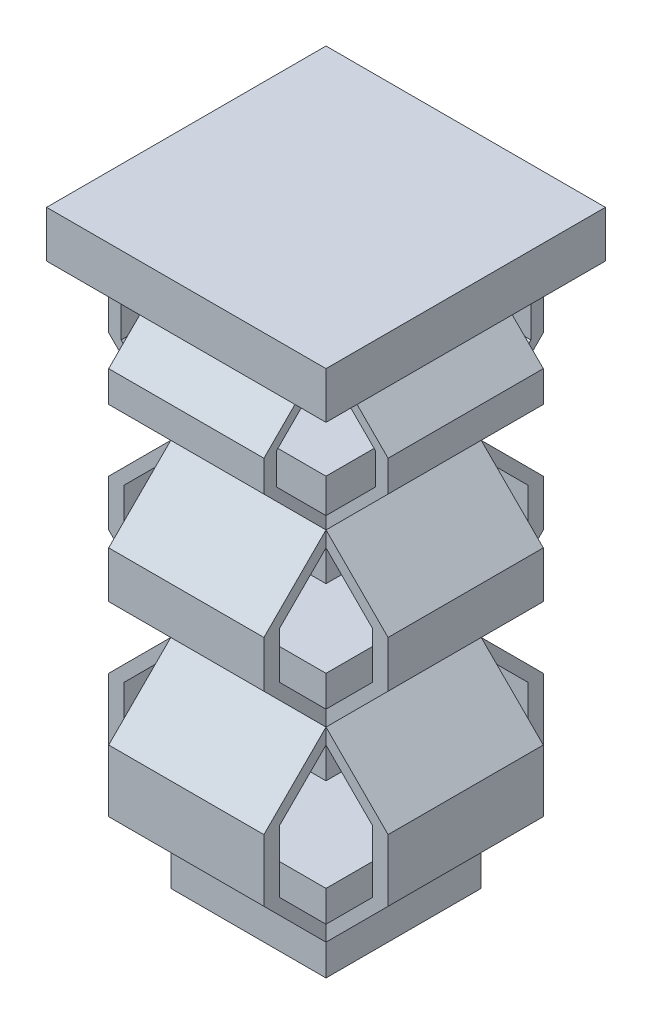
from build123d import *

# Parameters (mm, degrees)
SKETCH2_W                = 5
SKETCH2_H                = 5
BOSS_EXTRUDE1_DEPTH      = 2.5
BOSS_EXTRUDE2_DEPTH      = 5
BOSS_EXTRUDE3_DEPTH      = 5
SKETCH5_W                = 0.5
SKETCH5_H                = 5
BOSS_EXTRUDE4_DEPTH      = 1
SKETCH6_W                = 5
SKETCH6_H                = 0.5
BOSS_EXTRUDE5_DEPTH      = 1
MIRROR3_START            = -2.5
MIRROR3_OUTLINE_W        = 0.5
MIRROR3_OUTLINE_H        = 1
MIRROR3_DEPTH            = 5
MIRROR5_COPY_1_DEPTH     = 5
MIRROR5_COPY_2_DEPTH     = 5
MIRROR6_START            = -2.5
MIRROR6_OUTLINE_W        = 1
MIRROR6_OUTLINE_H        = 0.5
MIRROR6_DEPTH            = 5
BOSS_EXTRUDE7_DEPTH      = 5
BOSS_EXTRUDE9_DEPTH      = 5
SKETCH10_W               = 5
SKETCH10_H               = 1
CUT_EXTRUDE1_DEPTH       = 12.543396381
SKETCH11_W               = 5
SKETCH11_H               = 5
BOSS_EXTRUDE11_DEPTH     = 1.5
BOSS_EXTRUDE13_DEPTH     = 5
BOSS_EXTRUDE14_DEPTH     = 5
SKETCH15_W               = 0.5
SKETCH15_H               = 5
BOSS_EXTRUDE15_DEPTH     = 0.75
SKETCH16_W               = 5
SKETCH16_H               = 0.5
BOSS_EXTRUDE16_DEPTH     = 0.75
MIRROR16_COPY_1_SKETCH_W = 0.5
MIRROR16_COPY_1_SKETCH_H = 5
MIRROR16_COPY_1_DEPTH    = 0.75
MIRROR16_COPY_2_SKETCH_W = 5
MIRROR16_COPY_2_SKETCH_H = 0.5
MIRROR16_COPY_2_DEPTH    = 0.75
MIRROR18_COPY_1_DEPTH    = 5
BOSS_EXTRUDE18_DEPTH     = 5
BOSS_EXTRUDE19_DEPTH     = 5
SKETCH20_W               = 5
SKETCH20_H               = 5
BOSS_EXTRUDE20_DEPTH     = 1.5
BOSS_EXTRUDE21_DEPTH     = 5
BOSS_EXTRUDE22_DEPTH     = 5
SKETCH23_W               = 0.4
SKETCH23_H               = 5
BOSS_EXTRUDE23_DEPTH     = 0.5
SKETCH24_W               = 5
SKETCH24_H               = 0.4
BOSS_EXTRUDE24_DEPTH     = 0.5
MIRROR24_START           = -2.5
MIRROR24_OUTLINE_W       = 0.4
MIRROR24_OUTLINE_H       = 0.5
MIRROR24_DEPTH           = 5
MIRROR25_START           = -2.5
MIRROR25_DEPTH           = 5
MIRROR26_START           = -2.5
MIRROR26_OUTLINE_W       = 0.5
MIRROR26_OUTLINE_H       = 0.4
MIRROR26_DEPTH           = 5
BOSS_EXTRUDE25_DEPTH     = 5
BOSS_EXTRUDE26_DEPTH     = 5
SKETCH27_W               = 9
SKETCH27_H               = 9
BOSS_EXTRUDE27_DEPTH     = 1.5


# Read off the part's stored shape, not the designer's step: Mirror3, Mirror6, Mirror24, Mirror25, Mirror26
with BuildPart() as part:
    # Sketch2 → Boss-Extrude1 (new body)
    with BuildSketch(Plane(origin=(0, 0, 0), x_dir=(1, 0, 0), z_dir=(0, 1, 0))):
        Rectangle(SKETCH2_W, SKETCH2_H)
    boss_extrude1 = extrude(amount=BOSS_EXTRUDE1_DEPTH)

    # Sketch3 → Boss-Extrude2 (add)
    with BuildSketch(Plane.XY.offset(2.5)):
        Polygon((-2.5, 1.5), (-4, 3), (-4.5, 3), (-2.5, 1), align=None)
    boss_extrude2 = extrude(amount=-BOSS_EXTRUDE2_DEPTH)

    # Sketch4 → Boss-Extrude3 (add)
    with BuildSketch(Plane(origin=(2.5, 0, 0), x_dir=(0, 0, -1), z_dir=(1, 0, 0))):
        Polygon((2.5, 1.5), (2.5, 1), (4.5, 3), (4, 3), align=None)
    boss_extrude3 = extrude(amount=-BOSS_EXTRUDE3_DEPTH)

    # Sketch5 → Boss-Extrude4 (add)
    with BuildSketch(Plane(origin=(0, 3, 0), x_dir=(1, 0, 0), z_dir=(0, 1, 0))):
        with Locations((-4.25, 0)):
            Rectangle(SKETCH5_W, SKETCH5_H)
    boss_extrude4 = extrude(amount=BOSS_EXTRUDE4_DEPTH)

    # Sketch6 → Boss-Extrude5 (add)
    with BuildSketch(Plane(origin=(0, 3, 0), x_dir=(1, 0, 0), z_dir=(0, 1, 0))):
        with Locations((0, 4.25)):
            Rectangle(SKETCH6_W, SKETCH6_H)
    boss_extrude5 = extrude(amount=BOSS_EXTRUDE5_DEPTH)

    # Mirror1: Boss-Extrude3, Boss-Extrude5 across plane
    add(boss_extrude3.mirror(Plane.XY))
    add(boss_extrude5.mirror(Plane.XY))

    # Mirror2: Boss-Extrude2, Boss-Extrude4 across plane
    add(boss_extrude2.mirror(Plane(origin=(0, 0, 0), x_dir=(0, 0, 1), z_dir=(1, 0, 0))))
    add(boss_extrude4.mirror(Plane(origin=(0, 0, 0), x_dir=(0, 0, 1), z_dir=(1, 0, 0))))

    # Mirror3 outline → Mirror3 (add)
    with BuildSketch(Plane.XY.offset(MIRROR3_START)):
        with Locations((-4.25, 4.5)):
            Rectangle(MIRROR3_OUTLINE_W, MIRROR3_OUTLINE_H)
        with Locations((4.25, 4.5)):
            Rectangle(MIRROR3_OUTLINE_W, MIRROR3_OUTLINE_H)
    extrude(amount=MIRROR3_DEPTH)

    # Mirror4: Boss-Extrude2 across plane
    add(boss_extrude2.mirror(Plane.ZX.offset(4)))

    # Mirror5 copy 1 sketch → Mirror5 copy 1 (add)
    with BuildSketch(Plane(origin=(0, 8, 2.5), x_dir=(-1, 0, 0), z_dir=(0, 0, 1))):
        Polygon((-2.5, 1.5), (-4, 3), (-4.5, 3), (-2.5, 1), align=None)
    extrude(amount=-MIRROR5_COPY_1_DEPTH)

    # Mirror5 copy 2 sketch → Mirror5 copy 2 (add)
    with BuildSketch(Plane(origin=(0, 0, 2.5), x_dir=(-1, 0, 0), z_dir=(0, 0, 1))):
        Polygon((-2.5, -1.5), (-4, -3), (-4.5, -3), (-2.5, -1), align=None)
    extrude(amount=-MIRROR5_COPY_2_DEPTH)

    # Mirror6 outline → Mirror6 (add)
    with BuildSketch(Plane.YZ.offset(MIRROR6_START)):
        with Locations((4.5, -4.25)):
            Rectangle(MIRROR6_OUTLINE_W, MIRROR6_OUTLINE_H)
        with Locations((4.5, 4.25)):
            Rectangle(MIRROR6_OUTLINE_W, MIRROR6_OUTLINE_H)
    extrude(amount=MIRROR6_DEPTH)

    # Mirror10: Boss-Extrude1 across plane
    add(boss_extrude1.mirror(Plane.ZX.offset(4)))

    # Sketch10 → Cut-Extrude1 (cut, through all)
    with BuildSketch(Plane.XY.offset(2.5)):
        with Locations((0, 7.5)):
            Rectangle(SKETCH10_W, SKETCH10_H)
    extrude(amount=-CUT_EXTRUDE1_DEPTH, mode=Mode.SUBTRACT)



with BuildPart() as body_2:
    # Sketch7 → Boss-Extrude7 (new body)
    with BuildSketch(Plane.ZY.offset(2.5)):
        Polygon((-4.5, 5), (-4, 5), (-2.5, 6.5), (-2.5, 7), align=None)
    extrude(amount=-BOSS_EXTRUDE7_DEPTH)


with BuildPart() as body_3:
    # Sketch8 → Boss-Extrude9 (new body)
    with BuildSketch(Plane.ZY.offset(2.5)):
        Polygon((4.5, 5), (4, 5), (2.5, 6.5), (2.5, 7), align=None)
    extrude(amount=-BOSS_EXTRUDE9_DEPTH)


with BuildPart() as part_1:
    add(part.part)

    add(body_2.part)  # Boss-Extrude11 merges body 2

    add(body_3.part)  # Boss-Extrude11 merges body 3
    # Sketch11 → Boss-Extrude11 (add)
    with BuildSketch(Plane(origin=(0, 7, 0), x_dir=(1, 0, 0), z_dir=(0, 1, 0))):
        Rectangle(SKETCH11_W, SKETCH11_H)
    boss_extrude11 = extrude(amount=BOSS_EXTRUDE11_DEPTH)

    # Sketch13 → Boss-Extrude13 (add)
    with BuildSketch(Plane.ZY.offset(2.5)):
        Polygon((2.5, 7), (2.5, 7.5), (4, 9), (4.5, 9), align=None)
    boss_extrude13 = extrude(amount=-BOSS_EXTRUDE13_DEPTH)

    # Sketch14 → Boss-Extrude14 (add)
    with BuildSketch(Plane(origin=(0, 0, -2.5), x_dir=(-1, 0, 0), z_dir=(0, 0, -1))):
        Polygon((2.5, 7), (4.5, 9), (4, 9), (2.5, 7.5), align=None)
    boss_extrude14 = extrude(amount=-BOSS_EXTRUDE14_DEPTH)

    # Mirror12: Boss-Extrude13 across plane
    add(boss_extrude13.mirror(Plane.XY))

    # Mirror13: Boss-Extrude14 across plane
    add(boss_extrude14.mirror(Plane(origin=(0, 0, 0), x_dir=(0, 0, 1), z_dir=(1, 0, 0))))

    # Sketch15 → Boss-Extrude15 (add)
    with BuildSketch(Plane(origin=(0, 9, 0), x_dir=(1, 0, 0), z_dir=(0, 1, 0))):
        with Locations((-4.25, 0)):
            Rectangle(SKETCH15_W, SKETCH15_H)
    boss_extrude15 = extrude(amount=BOSS_EXTRUDE15_DEPTH)

    # Sketch16 → Boss-Extrude16 (add)
    with BuildSketch(Plane(origin=(0, 9, 0), x_dir=(1, 0, 0), z_dir=(0, 1, 0))):
        with Locations((0, 4.25)):
            Rectangle(SKETCH16_W, SKETCH16_H)
    boss_extrude16 = extrude(amount=BOSS_EXTRUDE16_DEPTH)

    # Mirror14: Boss-Extrude15 across plane
    add(boss_extrude15.mirror(Plane(origin=(0, 0, 0), x_dir=(0, 0, 1), z_dir=(1, 0, 0))))

    # Mirror15: Boss-Extrude16 across plane
    add(boss_extrude16.mirror(Plane.XY))

    # Mirror16: Boss-Extrude15, Boss-Extrude16 across plane
    add(boss_extrude15.mirror(Plane.ZX.offset(9.75)))
    add(boss_extrude16.mirror(Plane.ZX.offset(9.75)))

    # Mirror16 copy 1 sketch → Mirror16 copy 1 (add)
    with BuildSketch(Plane(origin=(0, 10.5, 0), x_dir=(-1, 0, 0), z_dir=(0, -1, 0))):
        with Locations((-4.25, 0)):
            Rectangle(MIRROR16_COPY_1_SKETCH_W, MIRROR16_COPY_1_SKETCH_H)
    extrude(amount=MIRROR16_COPY_1_DEPTH)

    # Mirror16 copy 2 sketch → Mirror16 copy 2 (add)
    with BuildSketch(Plane.XZ.offset(-10.5)):
        with Locations((0, 4.25)):
            Rectangle(MIRROR16_COPY_2_SKETCH_W, MIRROR16_COPY_2_SKETCH_H)
    extrude(amount=MIRROR16_COPY_2_DEPTH)

    # Mirror18: Boss-Extrude14 across plane
    add(boss_extrude14.mirror(Plane.ZX.offset(9.75)))

    # Mirror18 copy 1 sketch → Mirror18 copy 1 (add)
    with BuildSketch(Plane(origin=(0, 19.5, -2.5), x_dir=(1, 0, 0), z_dir=(0, 0, -1))):
        Polygon((2.5, 7), (4.5, 9), (4, 9), (2.5, 7.5), align=None)
    extrude(amount=-MIRROR18_COPY_1_DEPTH)

    # Mirror21: Boss-Extrude11 across plane
    add(boss_extrude11.mirror(Plane.ZX.offset(9.75)))



with BuildPart() as body_2_2:
    # Sketch17 → Boss-Extrude18 (new body)
    with BuildSketch(Plane(origin=(2.5, 0, 0), x_dir=(0, 0, -1), z_dir=(1, 0, 0))):
        Polygon((4, 10.5), (4.5, 10.5), (2.5, 12.5), (2.5, 12), align=None)
    extrude(amount=-BOSS_EXTRUDE18_DEPTH)


with BuildPart() as body_3_2:
    # Sketch18 → Boss-Extrude19 (new body)
    with BuildSketch(Plane(origin=(2.5, 0, 0), x_dir=(0, 0, -1), z_dir=(1, 0, 0))):
        Polygon((-4.5, 10.5), (-4, 10.5), (-2.5, 12), (-2.5, 12.5), align=None)
    extrude(amount=-BOSS_EXTRUDE19_DEPTH)


with BuildPart() as part_2:
    add(part_1.part)

    add(body_2_2.part)  # Boss-Extrude20 merges body 2 2

    add(body_3_2.part)  # Boss-Extrude20 merges body 3 2
    # Sketch20 → Boss-Extrude20 (add)
    with BuildSketch(Plane(origin=(0, 12.5, 0), x_dir=(1, 0, 0), z_dir=(0, 1, 0))):
        Rectangle(SKETCH20_W, SKETCH20_H)
    boss_extrude20 = extrude(amount=BOSS_EXTRUDE20_DEPTH)

    # Sketch21 → Boss-Extrude21 (add)
    with BuildSketch(Plane.XY.offset(2.5)):
        Polygon((2.5, 12.5), (2.5, 12.9), (4.1, 14.5), (4.5, 14.5), align=None)
    boss_extrude21 = extrude(amount=-BOSS_EXTRUDE21_DEPTH)

    # Sketch22 → Boss-Extrude22 (add)
    with BuildSketch(Plane.ZY.offset(2.5)):
        Polygon((2.5, 12.5), (2.5, 12.9), (4.1, 14.5), (4.5, 14.5), align=None)
    boss_extrude22 = extrude(amount=-BOSS_EXTRUDE22_DEPTH)

    # Sketch23 → Boss-Extrude23 (add)
    with BuildSketch(Plane(origin=(0, 14.5, 0), x_dir=(1, 0, 0), z_dir=(0, 1, 0))):
        with Locations((4.3, 0)):
            Rectangle(SKETCH23_W, SKETCH23_H)
    boss_extrude23 = extrude(amount=BOSS_EXTRUDE23_DEPTH)

    # Sketch24 → Boss-Extrude24 (add)
    with BuildSketch(Plane(origin=(0, 14.5, 0), x_dir=(1, 0, 0), z_dir=(0, 1, 0))):
        with Locations((0, -4.3)):
            Rectangle(SKETCH24_W, SKETCH24_H)
    boss_extrude24 = extrude(amount=BOSS_EXTRUDE24_DEPTH)

    # Mirror22: Boss-Extrude22, Boss-Extrude24 across plane
    add(boss_extrude22.mirror(Plane.XY))
    add(boss_extrude24.mirror(Plane.XY))

    # Mirror23: Boss-Extrude21, Boss-Extrude23 across plane
    add(boss_extrude21.mirror(Plane(origin=(0, 0, 0), x_dir=(0, 0, 1), z_dir=(1, 0, 0))))
    add(boss_extrude23.mirror(Plane(origin=(0, 0, 0), x_dir=(0, 0, 1), z_dir=(1, 0, 0))))

    # Mirror24 outline → Mirror24 (add)
    with BuildSketch(Plane.XY.offset(MIRROR24_START)):
        with Locations((-4.3, 15.25)):
            Rectangle(MIRROR24_OUTLINE_W, MIRROR24_OUTLINE_H)
        with Locations((4.3, 15.25)):
            Rectangle(MIRROR24_OUTLINE_W, MIRROR24_OUTLINE_H)
    extrude(amount=MIRROR24_DEPTH)

    # Mirror25 outline → Mirror25 (add)
    with BuildSketch(Plane.XY.offset(MIRROR25_START)):
        Polygon((-2.5, 17.1), (-2.5, 17.5), (-4.5, 15.5), (-4.1, 15.5), align=None)
        Polygon((4.5, 15.5), (2.5, 17.5), (2.5, 17.1), (4.1, 15.5), align=None)
    extrude(amount=MIRROR25_DEPTH)

    # Mirror26 outline → Mirror26 (add)
    with BuildSketch(Plane.YZ.offset(MIRROR26_START)):
        with Locations((15.25, -4.3)):
            Rectangle(MIRROR26_OUTLINE_W, MIRROR26_OUTLINE_H)
        with Locations((15.25, 4.3)):
            Rectangle(MIRROR26_OUTLINE_W, MIRROR26_OUTLINE_H)
    extrude(amount=MIRROR26_DEPTH)

    # Mirror28: Boss-Extrude20 across plane
    add(boss_extrude20.mirror(Plane.ZX.offset(15)))



with BuildPart() as body_2_3:
    # Sketch25 → Boss-Extrude25 (new body)
    with BuildSketch(Plane.ZY.offset(2.5)):
        Polygon((4.1, 15.5), (4.5, 15.5), (2.5, 17.5), (2.5, 17.1), align=None)
    extrude(amount=-BOSS_EXTRUDE25_DEPTH)


with BuildPart() as body_3_3:
    # Sketch26 → Boss-Extrude26 (new body)
    with BuildSketch(Plane.ZY.offset(2.5)):
        Polygon((-4.1, 15.5), (-4.5, 15.5), (-2.5, 17.5), (-2.5, 17.1), align=None)
    extrude(amount=-BOSS_EXTRUDE26_DEPTH)


with BuildPart() as part_3:
    add(part_2.part)

    add(body_2_3.part)  # Boss-Extrude27 merges body 2 3

    add(body_3_3.part)  # Boss-Extrude27 merges body 3 3
    # Sketch27 → Boss-Extrude27 (add)
    with BuildSketch(Plane(origin=(0, 17.5, 0), x_dir=(1, 0, 0), z_dir=(0, 1, 0))):
        Rectangle(SKETCH27_W, SKETCH27_H)
    extrude(amount=BOSS_EXTRUDE27_DEPTH)


solid = part_3.part
